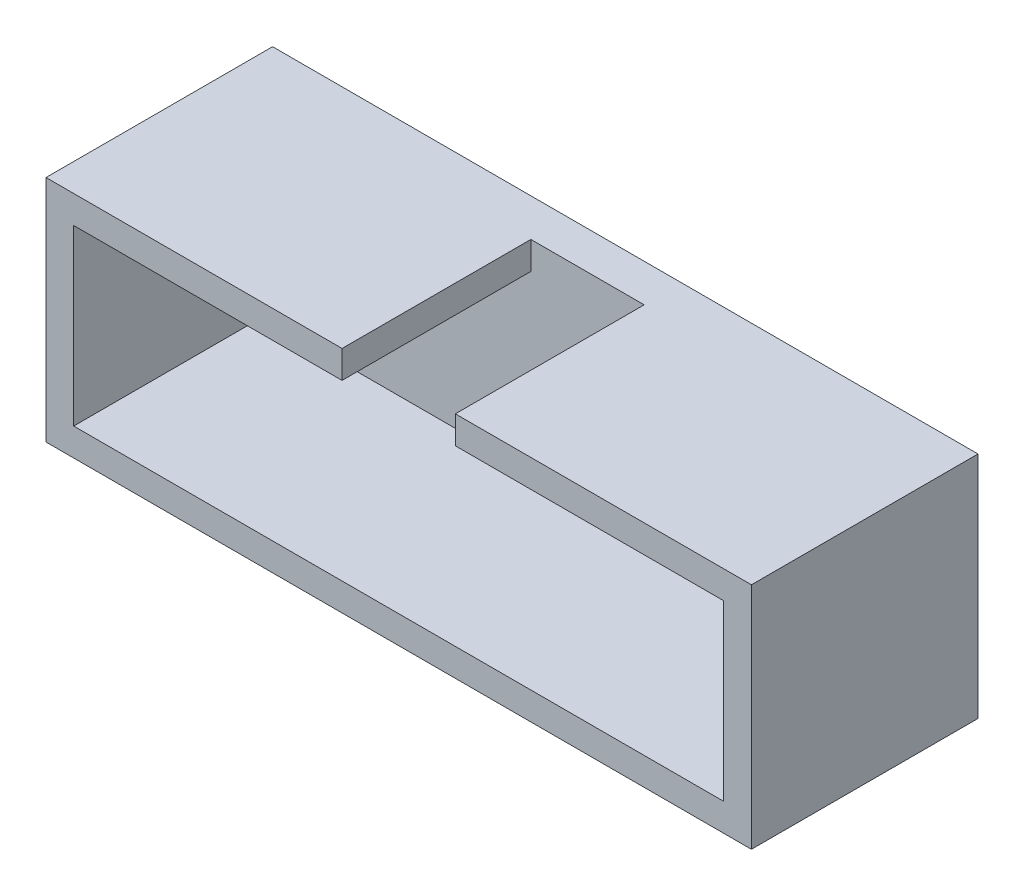
from build123d import *

# Parameters (mm, degrees)
SKETCH_2_W          = 28.02
SKETCH_2_H          = 9.1
EXTRUDE_1_DEPTH     = 9
SKETCH_3_W          = 25.82
SKETCH_3_H          = 6.9
CUT_EXTRUDE_1_DEPTH = 7.5
SKETCH_4_W          = 4.5
SKETCH_4_H          = 1.1
CUT_EXTRUDE_2_DEPTH = 7.5


with BuildPart() as part:
    # Эскиз2 → Бобышка-Вытянуть1 (new body)
    with BuildSketch(Plane.XY):
        Rectangle(SKETCH_2_W, SKETCH_2_H)
    extrude(amount=EXTRUDE_1_DEPTH)

    # Эскиз3 → Вырез-Вытянуть1 (cut)
    with BuildSketch(Plane.XY.offset(9)):
        Rectangle(SKETCH_3_W, SKETCH_3_H)
    extrude(amount=-CUT_EXTRUDE_1_DEPTH, mode=Mode.SUBTRACT)

    # Эскиз4 → Вырез-Вытянуть2 (cut)
    with BuildSketch(Plane.XY.offset(9)):
        with Locations((0, 4)):
            Rectangle(SKETCH_4_W, SKETCH_4_H)
    extrude(amount=-CUT_EXTRUDE_2_DEPTH, mode=Mode.SUBTRACT)


solid = part.part
